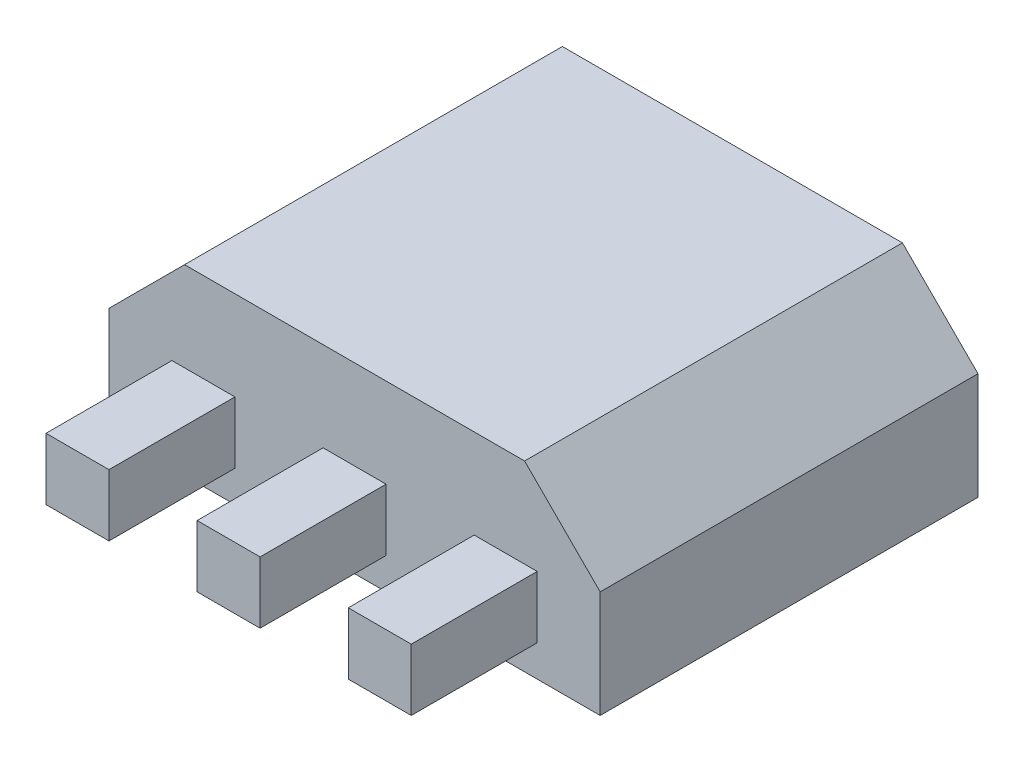
from build123d import *

# Parameters (mm, degrees)
SKETCH1_W           = 3.9
SKETCH1_H           = 3
BOSS_EXTRUDE1_DEPTH = 1.45
CHAMFER1_SIZE       = 0.6
SKETCH2_W           = 0.5
SKETCH2_H           = 0.490574161
BOSS_EXTRUDE2_DEPTH = 1


with BuildPart() as part:
    # Sketch1 → Boss-Extrude1 (new body)
    with BuildSketch(Plane(origin=(0, 0, 0), x_dir=(1, 0, 0), z_dir=(0, 1, 0))):
        with Locations((1.95, 1.5)):
            Rectangle(SKETCH1_W, SKETCH1_H)
    extrude(amount=BOSS_EXTRUDE1_DEPTH)

    # Chamfer1
    chamfer1_edges = [part.edges().sort_by_distance(p)[0] for p in [
        (0, 1.45, -1.5),
        (3.9, 1.45, -1.5),
    ]]
    chamfer(chamfer1_edges, length=CHAMFER1_SIZE)

    # Sketch2 → Boss-Extrude2 (add)
    with BuildSketch(Plane.XY):
        with Locations((0.75, 0.495287081)):
            Rectangle(SKETCH2_W, SKETCH2_H)
        with Locations((1.95, 0.495287081)):
            Rectangle(SKETCH2_W, SKETCH2_H)
        with Locations((3.15, 0.495287081)):
            Rectangle(SKETCH2_W, SKETCH2_H)
    extrude(amount=BOSS_EXTRUDE2_DEPTH)


solid = part.part
